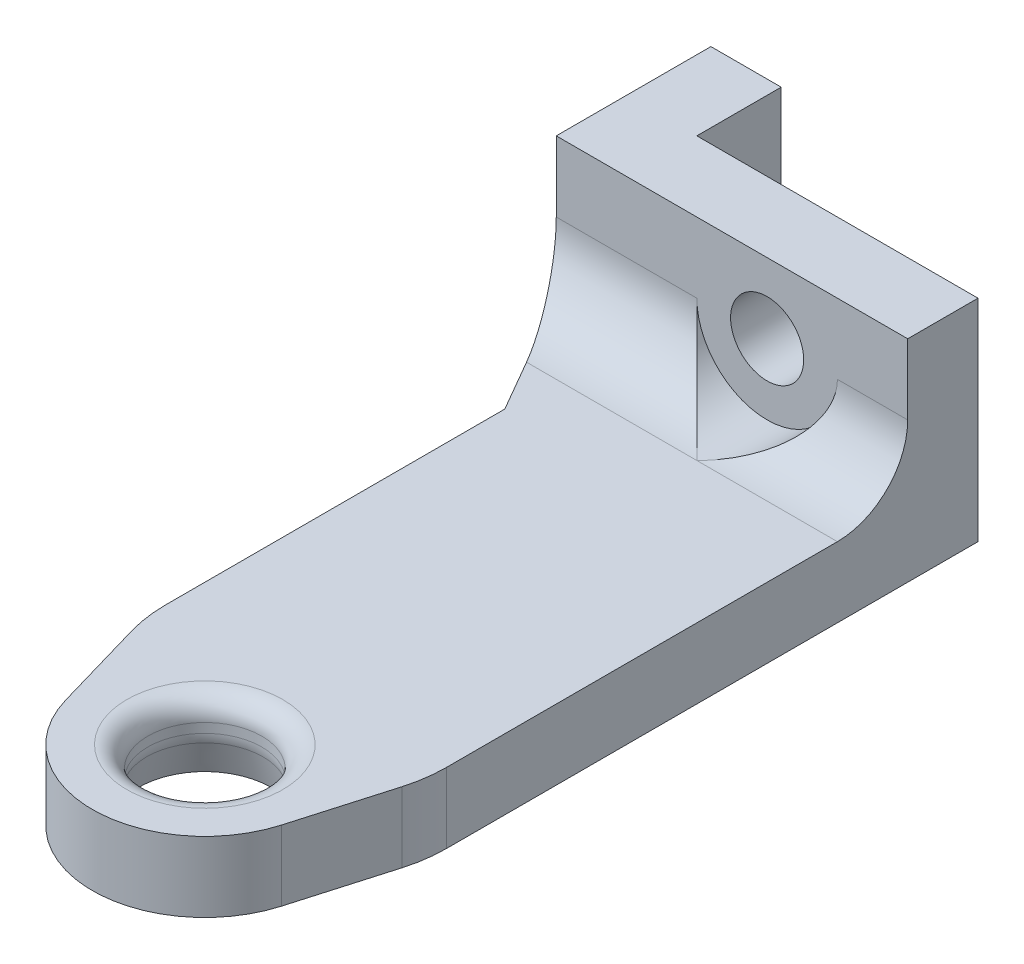
from build123d import *

# Parameters (mm, degrees)
SKETCH2_R           = 4.05
BOSS_EXTRUDE1_DEPTH = 5
FILLET1_R           = 10
SKETCH3_W           = 20
SKETCH3_H           = 15
BOSS_EXTRUDE2_DEPTH = 5
SKETCH6_R           = 2.6
CUT_EXTRUDE1_DEPTH  = 52.273774973
SKETCH4_W           = 11
SKETCH4_H           = 15
BOSS_EXTRUDE3_DEPTH = 5
CHAMFER1_SIZE2      = 5
CHAMFER1_SIZE       = 8.660254038
FILLET2_R           = 5
SKETCH7_R           = 5
CUT_EXTRUDE3_DEPTH  = 53.478567054
CHAMFER2_SIZE       = 2.5
CHAMFER2_SIZE2      = 0.669872981
FILLET3_R           = 2.5
FILLET4_R           = 1.5
SKETCH8_W           = 0.542735043
SKETCH8_H           = 2.03525641
CUT_EXTRUDE4_DEPTH  = 0.4


# Some blends are built 0.0001 mm under size
with BuildPart() as part:
    # Sketch2 → Boss-Extrude1 (new body)
    with BuildSketch(Plane(origin=(0, 0, 0), x_dir=(1, 0, 0), z_dir=(0, 1, 0))):
        with BuildLine():
            Line((-7.684618874, -2.224102688), (-10, 5.775897312))
            Line((-10, 5.775897312), (-10, 45))
            Line((-10, 45), (10, 45))
            Line((10, 45), (10, 5.775897312))
            Line((10, 5.775897312), (7.684618874, -2.224102688))
            ThreePointArc((7.684618874, -2.224102688), (0, -8), (-7.684618874, -2.224102688))
        make_face()
        with Locations(Location((0, 0, 0), (0, 0, 270))):
            Circle(SKETCH2_R, mode=Mode.SUBTRACT)
    extrude(amount=BOSS_EXTRUDE1_DEPTH)

    # Fillet1
    fillet1_edges = [part.edges().sort_by_distance(p)[0] for p in [
        (-10, 2.5, -5.775897312),
        (10, 2.5, -5.775897312),
    ]]
    fillet(fillet1_edges, radius=FILLET1_R)

    # Sketch3 → Boss-Extrude2 (add)
    with BuildSketch(Plane(origin=(0, 0, -45), x_dir=(-1, 0, 0), z_dir=(0, 0, -1))):
        with Locations((0, 7.5)):
            Rectangle(SKETCH3_W, SKETCH3_H)
    extrude(amount=-BOSS_EXTRUDE2_DEPTH)

    # Sketch6 → Cut-Extrude1 (cut, through all)
    with BuildSketch(Plane.XY.offset(-40)):
        with Locations((0, 10)):
            Circle(SKETCH6_R)
    extrude(amount=-CUT_EXTRUDE1_DEPTH, mode=Mode.SUBTRACT)

    # Sketch4 → Boss-Extrude3 (add)
    with BuildSketch(Plane.ZY.offset(10)):
        with Locations((-45.5, 7.5)):
            Rectangle(SKETCH4_W, SKETCH4_H)
    extrude(amount=BOSS_EXTRUDE3_DEPTH)

    # Chamfer1
    chamfer1_edges = [part.edges().sort_by_distance(p)[0] for p in [
        (-10, 2.5, -40),
    ]]
    chamfer1_side = [part.faces().sort_by_distance(p)[0] for p in [
        (-10, 2.5, -39.9),
    ]]
    chamfer(chamfer1_edges, length=CHAMFER1_SIZE - 0.0001, length2=CHAMFER1_SIZE2 - 0.0001, reference=chamfer1_side[0])  # a hair under: the kernel refuses the full size

    # Fillet2
    # the kernel refuses this fillet: 5 mm, written as the material it adds along each edge
    with BuildSketch(Plane(origin=(10, 5, -40), x_dir=(0, 0, 1), z_dir=(-1, 0, 0))) as fillet2_piece_1_section:
        with BuildLine():
            CenterArc((FILLET2_R, FILLET2_R), FILLET2_R, 180, 90)
            Line((0, FILLET2_R), (0, 0))
            Line((0, 0), (FILLET2_R, 0))
        make_face()
    fillet2_piece_1 = extrude(amount=37.4999, mode=Mode.PRIVATE)
    fillet2_piece_1 = split(fillet2_piece_1, bisect_by=Plane(origin=(-11.31874523, 6.103581905, -33.623999011), z_dir=(0.8660272339345468, 0, -0.4999968300736293)), keep=Keep.TOP, mode=Mode.PRIVATE)
    fillet2_piece_1 = fillet2_piece_1 - Plane(origin=(0, 10, -38.876099695), x_dir=(1, 0, 0), z_dir=(0, 0, 1)) * Cylinder(2.6, 95, mode=Mode.PRIVATE)
    fillet2_piece_1 = split(fillet2_piece_1, bisect_by=Plane(origin=(-15, 6.103581905, -38.876099695), z_dir=(1, 0, 0)), keep=Keep.TOP, mode=Mode.PRIVATE)
    add(fillet2_piece_1)

    # Sketch7 → Cut-Extrude3 (cut, through all)
    with BuildSketch(Plane.XY.offset(-40)):
        with Locations((0, 10)):
            Circle(SKETCH7_R)
    extrude(amount=CUT_EXTRUDE3_DEPTH, mode=Mode.SUBTRACT)

    # Chamfer2
    chamfer2_edges = [part.edges().sort_by_distance(p)[0] for p in [
        (0, 0, -4.05),
    ]]
    chamfer2_side = [part.faces().sort_by_distance(p)[0] for p in [
        (0, 2.5, -4.05),
    ]]
    chamfer(chamfer2_edges, length=CHAMFER2_SIZE, length2=CHAMFER2_SIZE2, reference=chamfer2_side[0])

    # Fillet3
    fillet3_edges = [part.edges().sort_by_distance(p)[0] for p in [
        (0, 2.5, -4.05),
    ]]
    fillet(fillet3_edges, radius=FILLET3_R)

    # Fillet4
    fillet4_edges = [part.edges().sort_by_distance(p)[0] for p in [
        (0, 5, -4.05),
    ]]
    fillet(fillet4_edges, radius=FILLET4_R)

    # Sketch8 → Cut-Extrude4 (cut)
    # profile 1 of 6: a face of its own
    with BuildSketch(Plane.XZ):
        with BuildLine():
            Line((-2.291666667, -36.651175214), (-2.291666667, -35.618706597))
            add(Edge.make_bspline(
                [(-2.291666667, -35.618706597), (-2.291405132, -35.568165125), (-2.290898213, -35.470203173), (-2.282853771, -35.327763182), (-2.272159447, -35.194301861), (-2.254220293, -35.070055051), (-2.235619757, -34.954214297), (-2.208318623, -34.847955627), (-2.178163526, -34.750388992), (-2.131765816, -34.633231433), (-2.059709589, -34.500300129), (-1.952843356, -34.357423851), (-1.824719372, -34.233227072), (-1.678711987, -34.127622996), (-1.518087317, -34.042873478), (-1.346301255, -33.982336608), (-1.166243896, -33.943445417), (-1.042797928, -33.939495981), (-0.980410323, -33.9375)],
                knots=[0, 0, 0, 0, 1.00128172, 1.940733171, 2.826250472, 3.653024905, 4.427672124, 5.149348099, 5.824709082, 6.450061444, 7.643590664, 8.808605388, 9.972104426, 11.165284501, 12.367876273, 13.557044126, 14.765369432, 16, 16, 16, 16], degree=3))
            add(Edge.make_bspline(
                [(-0.980410323, -33.9375), (-0.92197391, -33.939162507), (-0.807140846, -33.942429489), (-0.639473873, -33.973288932), (-0.480032383, -34.022267279), (-0.328952834, -34.08995733), (-0.189047585, -34.177172174), (-0.060750024, -34.281667816), (0.051090906, -34.407218494), (0.113592766, -34.501331705), (0.145340879, -34.549136952)],
                knots=[0, 0, 0, 0, 1.044641374, 2.052818814, 3.038628718, 4.023282556, 5.005660861, 5.98021751, 6.974042014, 8, 8, 8, 8], degree=3))
            add(Edge.make_bspline(
                [(0.145340879, -34.549136952), (0.168427577, -34.489028777), (0.212598148, -34.374026948), (0.290569098, -34.21567636), (0.375681842, -34.079744802), (0.467193244, -33.963576922), (0.567287581, -33.864748126), (0.676778076, -33.779156673), (0.79557509, -33.705161195), (0.92324201, -33.642191555), (1.058696543, -33.592728117), (1.200284247, -33.556373176), (1.347462345, -33.534868439), (1.447340349, -33.531934862), (1.497938368, -33.530448718)],
                knots=[0, 0, 0, 0, 1.272586185, 2.434772614, 3.483318042, 4.437947805, 5.351807173, 6.25737843, 7.180033415, 8.1141739, 9.066731021, 10.025721652, 10.999834114, 12, 12, 12, 12], degree=3))
            add(Edge.make_bspline(
                [(1.497938368, -33.530448718), (1.549595635, -33.531925293), (1.651232755, -33.534830497), (1.80053811, -33.556273874), (1.943235076, -33.592556412), (2.080180884, -33.642619183), (2.211088406, -33.707508867), (2.335483408, -33.787618814), (2.453624692, -33.881824442), (2.565720763, -33.988292029), (2.668292193, -34.106941825), (2.756469031, -34.237701537), (2.832288545, -34.376988986), (2.89401809, -34.526584829), (2.941642392, -34.686107179), (2.974823432, -34.855467269), (2.997218281, -35.034386188), (2.999057027, -35.157168496), (3, -35.22013555)],
                knots=[0, 0, 0, 0, 0.978680899, 1.925582087, 2.851223405, 3.764209995, 4.683484765, 5.614004905, 6.562443559, 7.542772147, 8.539900013, 9.527881485, 10.525548727, 11.540192123, 12.58875426, 13.674701727, 14.807505862, 16, 16, 16, 16], degree=3))
            Line((3, -35.22013555), (3, -36.651175214))
            Line((3, -36.651175214), (-2.291666667, -36.651175214))
        make_face()
        with BuildLine():
            Line((-1.748931624, -36.176282051), (-0.052884615, -36.176282051))
            Line((-0.052884615, -36.176282051), (-0.052884615, -35.857213208))
            add(Edge.make_bspline(
                [(-0.052884615, -35.857213208), (-0.053489261, -35.810572767), (-0.054657559, -35.720453931), (-0.058004187, -35.58994647), (-0.067375034, -35.468805068), (-0.076743206, -35.35723886), (-0.09197498, -35.255423448), (-0.110106069, -35.163584679), (-0.129280956, -35.080280315), (-0.161893899, -34.984216823), (-0.210076793, -34.87523413), (-0.284925308, -34.759130076), (-0.374004491, -34.656299664), (-0.47775097, -34.570506474), (-0.590749128, -34.499671386), (-0.712006948, -34.450049179), (-0.839084272, -34.416967531), (-0.926491474, -34.413933571), (-0.970870059, -34.412393162)],
                knots=[0, 0, 0, 0, 1.156917035, 2.235399477, 3.236897345, 4.169954739, 5.01148057, 5.788325709, 6.491867502, 7.129259015, 8.302032419, 9.437271567, 10.542795419, 11.662606952, 12.764338259, 13.836858145, 14.901724648, 16, 16, 16, 16], degree=3))
            add(Edge.make_bspline(
                [(-0.970870059, -34.412393162), (-1.000243825, -34.413175287), (-1.057863676, -34.414709511), (-1.142133004, -34.42773128), (-1.221315262, -34.448830002), (-1.296170402, -34.477403358), (-1.364838095, -34.516438804), (-1.430599459, -34.561686014), (-1.48951571, -34.617550119), (-1.544423308, -34.680681517), (-1.593565423, -34.752915097), (-1.63427205, -34.835807132), (-1.671165779, -34.927214737), (-1.698477109, -35.029617849), (-1.722493142, -35.140894642), (-1.737582577, -35.262551845), (-1.747292771, -35.393818542), (-1.748373155, -35.484769875), (-1.748931624, -35.531784188)],
                knots=[0, 0, 0, 0, 0.911708768, 1.788416306, 2.640049961, 3.452993646, 4.268229297, 5.087074648, 5.92553149, 6.781184137, 7.681934069, 8.628939405, 9.643570426, 10.73771997, 11.914765019, 13.176320755, 14.540391495, 16, 16, 16, 16], degree=3))
            Line((-1.748931624, -35.531784188), (-1.748931624, -36.176282051))
        make_face(mode=Mode.SUBTRACT)
        with BuildLine():
            Line((0.489850427, -36.176282051), (2.457264957, -36.176282051))
            Line((2.457264957, -36.176282051), (2.457264957, -35.499983307))
            add(Edge.make_bspline(
                [(2.457264957, -35.499983307), (2.456627077, -35.451578803), (2.455397648, -35.358285504), (2.452514381, -35.223479932), (2.441607418, -35.098862051), (2.431545793, -34.984038735), (2.414340848, -34.879314727), (2.398103854, -34.783884484), (2.374001195, -34.699314558), (2.340874926, -34.60034818), (2.287843881, -34.489726643), (2.210366026, -34.368837215), (2.114746392, -34.263423508), (2.005997167, -34.17293568), (1.888079822, -34.098261195), (1.762535899, -34.044675189), (1.631806991, -34.011374934), (1.542651073, -34.007356946), (1.497938368, -34.00534188)],
                knots=[0, 0, 0, 0, 1.160376723, 2.23647316, 3.230273494, 4.158083346, 4.997711197, 5.773399541, 6.476071462, 7.102777513, 8.27340052, 9.405620712, 10.53304798, 11.669441455, 12.787990954, 13.865552736, 14.929550474, 16, 16, 16, 16], degree=3))
            add(Edge.make_bspline(
                [(1.497938368, -34.00534188), (1.469977596, -34.005758045), (1.414507062, -34.006583663), (1.333000258, -34.019091564), (1.254007275, -34.037186532), (1.177198938, -34.061018126), (1.103866677, -34.09433341), (1.033729262, -34.135175156), (0.965373798, -34.18192579), (0.877838706, -34.254053177), (0.778235912, -34.360494799), (0.68192319, -34.511760222), (0.602995846, -34.682804715), (0.569628744, -34.807151532), (0.552392161, -34.871385884)],
                knots=[0, 0, 0, 0, 0.723302347, 1.434937762, 2.129609326, 2.821140842, 3.513216847, 4.209993937, 4.920569932, 5.655069131, 7.14393391, 8.6716197, 10.280644748, 12, 12, 12, 12], degree=3))
            add(Edge.make_bspline(
                [(0.552392161, -34.871385884), (0.547168403, -34.897132255), (0.535842218, -34.952955698), (0.523886524, -35.043983826), (0.513235064, -35.147905913), (0.50535629, -35.26496193), (0.497212349, -35.395299976), (0.494045179, -35.539198412), (0.490266536, -35.69606959), (0.489992678, -35.804915201), (0.489850427, -35.861453325)],
                knots=[0, 0, 0, 0, 0.634451884, 1.375622551, 2.216452059, 3.157844607, 4.20941857, 5.370758133, 6.634282058, 8, 8, 8, 8], degree=3))
            Line((0.489850427, -35.861453325), (0.489850427, -36.176282051))
        make_face(mode=Mode.SUBTRACT)
    # profile 2 of 6: a face of its own
    with BuildSketch(Plane.XZ):
        Polygon((-2.291666667, -32.444978632), (-2.291666667, -31.97008547), (2.457264957, -31.97008547), (2.457264957, -29.93482906), (3, -29.93482906), (3, -32.444978632), align=None)
    # profile 3 of 6: a face of its own
    with BuildSketch(Plane.XZ):
        with BuildLine():
            Line((-2.291666667, -29.052884615), (-2.291666667, -27.993915264))
            add(Edge.make_bspline(
                [(-2.291666667, -27.993915264), (-2.291431435, -27.92324713), (-2.290979766, -27.787556483), (-2.288461291, -27.593165943), (-2.28124292, -27.416534499), (-2.275031133, -27.257754504), (-2.263704031, -27.11682887), (-2.252877814, -26.993325467), (-2.238705732, -26.887813114), (-2.225543962, -26.823941411), (-2.219584669, -26.795022035)],
                knots=[0, 0, 0, 0, 1.410062039, 2.707475311, 3.878576406, 4.937260626, 5.877586885, 6.699081471, 7.410979367, 8, 8, 8, 8], degree=3))
            add(Edge.make_bspline(
                [(-2.219584669, -26.795022035), (-2.210019176, -26.756307288), (-2.191092249, -26.679703685), (-2.151088227, -26.569409696), (-2.104792892, -26.46431227), (-2.050424199, -26.364838447), (-1.987548423, -26.271521625), (-1.917362949, -26.183268209), (-1.840009535, -26.100364674), (-1.754790866, -26.023892976), (-1.663522649, -25.954429825), (-1.566455374, -25.893499941), (-1.463990393, -25.84201531), (-1.355968109, -25.80161309), (-1.243581792, -25.767711188), (-1.12568437, -25.744933286), (-1.002669421, -25.730744878), (-0.918968364, -25.729343203), (-0.876527444, -25.728632479)],
                knots=[0, 0, 0, 0, 1.02737844, 2.032840108, 3.019645024, 3.985760442, 4.950801802, 5.916702504, 6.889791722, 7.870143693, 8.864820395, 9.842884691, 10.820524757, 11.815201459, 12.812418953, 13.84314332, 14.906358105, 16, 16, 16, 16], degree=3))
            add(Edge.make_bspline(
                [(-0.876527444, -25.728632479), (-0.806019607, -25.730853464), (-0.668440556, -25.735187181), (-0.46877708, -25.775592993), (-0.282526569, -25.841778921), (-0.109923533, -25.932981989), (0.045667562, -26.049125721), (0.182329322, -26.188712012), (0.296689666, -26.351818734), (0.375993311, -26.503658295), (0.426782589, -26.637785716), (0.462518513, -26.748205129), (0.490128865, -26.868654012), (0.514863826, -26.997978315), (0.533538412, -27.136716223), (0.547216001, -27.284535211), (0.555764384, -27.441540702), (0.557037415, -27.549398581), (0.557692308, -27.604884482)],
                knots=[0, 0, 0, 0, 1.260483769, 2.459530307, 3.627416485, 4.787058657, 5.939039949, 7.08810263, 8.267026773, 9.491475466, 10.141966685, 10.831826277, 11.566392101, 12.351337768, 13.187381173, 14.07005841, 15.007169909, 16, 16, 16, 16], degree=3))
            Line((0.557692308, -27.604884482), (3, -25.660790598))
            Line((3, -25.660790598), (3, -26.248046875))
            Line((3, -26.248046875), (0.557692308, -28.192140759))
            Line((0.557692308, -28.192140759), (0.557692308, -28.577991453))
            Line((0.557692308, -28.577991453), (3, -28.577991453))
            Line((3, -28.577991453), (3, -29.052884615))
            Line((3, -29.052884615), (-2.291666667, -29.052884615))
        make_face()
        with BuildLine():
            Line((-1.748931624, -28.577991453), (0.014957265, -28.577991453))
            Line((0.014957265, -28.577991453), (0.022377471, -27.609124599))
            add(Edge.make_bspline(
                [(0.022377471, -27.609124599), (0.022397495, -27.563888344), (0.022436307, -27.476207598), (0.016397941, -27.349357863), (0.009529412, -27.231247422), (-0.000979125, -27.122329572), (-0.014513976, -27.022550595), (-0.031470988, -26.931976927), (-0.051142008, -26.850406682), (-0.081903638, -26.755580285), (-0.128511472, -26.648440092), (-0.200901812, -26.53454777), (-0.28788413, -26.434616396), (-0.39021953, -26.353229714), (-0.500949552, -26.285040934), (-0.621208277, -26.239152597), (-0.747094629, -26.208569968), (-0.833588357, -26.205226469), (-0.877587473, -26.203525641)],
                knots=[0, 0, 0, 0, 1.146477201, 2.22219935, 3.21835465, 4.145220026, 4.995151787, 5.769831222, 6.480173269, 7.120302478, 8.295254187, 9.430763426, 10.528629691, 11.636497428, 12.733230534, 13.811001502, 14.886462612, 16, 16, 16, 16], degree=3))
            add(Edge.make_bspline(
                [(-0.877587473, -26.203525641), (-0.920138942, -26.205348379), (-1.004460427, -26.208960382), (-1.127967257, -26.238288162), (-1.244569168, -26.288426937), (-1.35441671, -26.354384717), (-1.45257154, -26.437162012), (-1.537466125, -26.532358387), (-1.606964031, -26.639955522), (-1.653154856, -26.73963391), (-1.680280691, -26.829442143), (-1.699996598, -26.907046756), (-1.713680172, -26.995163706), (-1.726641012, -27.093392265), (-1.737133161, -27.201919896), (-1.744370503, -27.321064684), (-1.748609016, -27.450088565), (-1.748821585, -27.539512688), (-1.748931624, -27.585803953)],
                knots=[0, 0, 0, 0, 1.100823979, 2.181431445, 3.263702604, 4.376021382, 5.48638238, 6.575013887, 7.666064109, 8.791843368, 9.405226397, 10.093019944, 10.863016055, 11.711746407, 12.658404307, 13.684961631, 14.801597923, 16, 16, 16, 16], degree=3))
            Line((-1.748931624, -27.585803953), (-1.748931624, -28.577991453))
        make_face(mode=Mode.SUBTRACT)
    # profile 4 of 6: a face of its own
    with BuildSketch(Plane.XZ):
        with Locations((0.96474359, -24.03258547)):
            Rectangle(SKETCH8_W, SKETCH8_H)
    # profile 5 of 6: a face of its own
    with BuildSketch(Plane.XZ):
        with BuildLine():
            add(Edge.make_bspline(
                [(0.356286725, -22.607905983), (0.271472818, -22.607410051), (0.10672058, -22.606446695), (-0.133346677, -22.595729678), (-0.358560447, -22.577926482), (-0.56893151, -22.55352831), (-0.764514182, -22.523837558), (-0.944785767, -22.484202227), (-1.110580689, -22.439128147), (-1.262439362, -22.386888011), (-1.40240851, -22.327942632), (-1.533073498, -22.263784501), (-1.654246443, -22.191876628), (-1.767826261, -22.116296397), (-1.872078268, -22.034101479), (-1.968203643, -21.947054289), (-2.055391743, -21.853413872), (-2.133702276, -21.754088453), (-2.202369187, -21.649751208), (-2.263225844, -21.543253282), (-2.313353149, -21.432691796), (-2.354358664, -21.319522228), (-2.387832412, -21.20350606), (-2.410825447, -21.084672911), (-2.425266903, -20.962747315), (-2.42664933, -20.880452652), (-2.427350427, -20.838716947)],
                knots=[0, 0, 0, 0, 1.646148282, 3.197666765, 4.66315463, 6.030252048, 7.307778049, 8.501004361, 9.610818041, 10.641065266, 11.615491391, 12.557119604, 13.464013759, 14.348536654, 15.203310953, 16.038349431, 16.863300206, 17.683791446, 18.490318933, 19.285717724, 20.06220424, 20.843281102, 21.620494212, 22.403315558, 23.190242141, 24, 24, 24, 24], degree=3))
            add(Edge.make_bspline(
                [(-2.427350427, -20.838716947), (-2.426766454, -20.796611945), (-2.425604553, -20.71283781), (-2.4092501, -20.58942836), (-2.388140934, -20.468168491), (-2.354285307, -20.350897957), (-2.313772659, -20.235399396), (-2.260316864, -20.124545026), (-2.202179536, -20.014421101), (-2.131256885, -19.910030404), (-2.052875685, -19.808253932), (-1.963892985, -19.712849115), (-1.866771391, -19.621377153), (-1.759344807, -19.537292904), (-1.6432604, -19.456992635), (-1.517545051, -19.383524625), (-1.38247736, -19.315360873), (-1.238683482, -19.251220083), (-1.08232246, -19.195130655), (-0.914369559, -19.145262671), (-0.733303883, -19.104387419), (-0.540134084, -19.070584305), (-0.333903201, -19.044346654), (-0.115029082, -19.025251335), (0.116625204, -19.015161118), (0.275009144, -19.013261268), (0.356286725, -19.012286325)],
                knots=[0, 0, 0, 0, 0.810910589, 1.61342667, 2.396193133, 3.181089899, 3.963115317, 4.752255436, 5.550715454, 6.36105385, 7.181178335, 8.024612154, 8.872680183, 9.750181803, 10.651284446, 11.591556747, 12.554036451, 13.566402641, 14.62422919, 15.753422176, 16.94128843, 18.199818041, 19.531985927, 20.947085226, 22.433341622, 24, 24, 24, 24], degree=3))
            add(Edge.make_bspline(
                [(0.356286725, -19.012286325), (0.437209068, -19.013282717), (0.595235899, -19.015228492), (0.825858718, -19.025034928), (1.043553058, -19.044813064), (1.248551014, -19.069192106), (1.44094763, -19.103373035), (1.620617541, -19.144558227), (1.78819686, -19.191482628), (1.942484903, -19.248432878), (2.086029255, -19.311080739), (2.220103801, -19.379171346), (2.345785951, -19.452224764), (2.462176548, -19.531320716), (2.56917194, -19.616788065), (2.666626644, -19.708195914), (2.756175312, -19.804433726), (2.835420039, -19.906803537), (2.906882659, -20.01216657), (2.967129759, -20.122301683), (3.019330335, -20.234390222), (3.062009122, -20.349551285), (3.095107019, -20.46760707), (3.117860021, -20.588950051), (3.133853634, -20.712855225), (3.135071606, -20.79661777), (3.135683761, -20.838716947)],
                knots=[0, 0, 0, 0, 1.561645053, 3.049612875, 4.452756685, 5.778837748, 7.032101753, 8.221335837, 9.334924186, 10.387562255, 11.392109817, 12.355697819, 13.287721948, 14.19548756, 15.068665045, 15.927346723, 16.771751757, 17.602390507, 18.423119567, 19.225778204, 20.022010933, 20.807278863, 21.593079439, 22.384715467, 23.188155646, 24, 24, 24, 24], degree=3))
            add(Edge.make_bspline(
                [(3.135683761, -20.838716947), (3.134978676, -20.880451738), (3.133588386, -20.962744601), (3.11920453, -21.084683387), (3.096079185, -21.203038985), (3.063699322, -21.318395439), (3.024064974, -21.431344557), (2.972427903, -21.540347344), (2.912958363, -21.646615371), (2.845232615, -21.74986668), (2.767636587, -21.848155128), (2.681824031, -21.942056584), (2.585594425, -22.02912524), (2.4804628, -22.110607454), (2.366713996, -22.186986704), (2.244271675, -22.258273198), (2.112926767, -22.323776773), (1.971851431, -22.383729224), (1.818914934, -22.43688376), (1.652697385, -22.483654562), (1.471510509, -22.521008965), (1.276274226, -22.552672596), (1.066591834, -22.578045078), (0.842387469, -22.595722285), (0.604086879, -22.606438559), (0.440394086, -22.607407916), (0.356286725, -22.607905983)],
                knots=[0, 0, 0, 0, 0.810927267, 1.598990287, 2.382942141, 3.152806972, 3.926217614, 4.706701772, 5.493896336, 6.292070767, 7.104102563, 7.925577746, 8.761822141, 9.623241997, 10.509042271, 11.423174113, 12.375371989, 13.360203808, 14.400680605, 15.520553799, 16.714061498, 17.994519714, 19.364400916, 20.818312473, 22.365209998, 24, 24, 24, 24], degree=3))
        make_face()
        with BuildLine():
            add(Edge.make_bspline(
                [(0.354166667, -22.133012821), (0.424845964, -22.132828268), (0.562020603, -22.132470088), (0.761006658, -22.12338368), (0.946912785, -22.110736327), (1.119666427, -22.094825229), (1.278663815, -22.070996097), (1.424565959, -22.04396049), (1.557102796, -22.01153293), (1.677432541, -21.972976119), (1.787259112, -21.929056158), (1.889509777, -21.881187474), (1.985396395, -21.829307212), (2.074686333, -21.77235194), (2.156288119, -21.709195612), (2.232270172, -21.642766164), (2.299989902, -21.570070984), (2.381222674, -21.46952813), (2.465160955, -21.336786111), (2.53825605, -21.169539156), (2.584191327, -20.997683124), (2.590032972, -20.881037802), (2.592948718, -20.822816506)],
                knots=[0, 0, 0, 0, 1.459098681, 2.831824031, 4.11146945, 5.306290378, 6.412266529, 7.42953815, 8.369053297, 9.227277979, 10.03601793, 10.809473603, 11.557037441, 12.285528272, 12.993193355, 13.685654407, 14.36688038, 15.041354379, 16.352855396, 17.594313975, 18.799247529, 20, 20, 20, 20], degree=3))
            add(Edge.make_bspline(
                [(2.592948718, -20.822816506), (2.590395634, -20.76425819), (2.585298522, -20.647349276), (2.540812942, -20.475651111), (2.468493515, -20.310344756), (2.385870284, -20.179886734), (2.306681713, -20.080912006), (2.239243685, -20.009972082), (2.163710982, -19.944868007), (2.082221544, -19.883118223), (1.993211631, -19.826483795), (1.897111163, -19.774983539), (1.793652737, -19.727988488), (1.721429445, -19.701214096), (1.684503539, -19.68752504)],
                knots=[0, 0, 0, 0, 1.353621445, 2.702441307, 4.075953605, 5.516772412, 6.261413105, 7.007624062, 7.778524365, 8.566925914, 9.372323995, 10.217594641, 11.088702136, 12, 12, 12, 12], degree=3))
            add(Edge.make_bspline(
                [(1.684503539, -19.68752504), (1.637287147, -19.671571772), (1.541417623, -19.639179796), (1.392701149, -19.597433423), (1.236668398, -19.564556451), (1.074251853, -19.534978505), (0.904253734, -19.514789956), (0.727200034, -19.498540286), (0.54295726, -19.48896889), (0.417779119, -19.487782421), (0.354166667, -19.487179487)],
                knots=[0, 0, 0, 0, 0.884706709, 1.796334032, 2.740027952, 3.714592787, 4.726048262, 5.777819803, 6.87074269, 8, 8, 8, 8], degree=3))
            add(Edge.make_bspline(
                [(0.354166667, -19.487179487), (0.290564503, -19.488011321), (0.166145076, -19.489638565), (-0.016066935, -19.495858523), (-0.189131289, -19.511920356), (-0.35379355, -19.529759501), (-0.509142225, -19.556062439), (-0.656477793, -19.584422468), (-0.793975029, -19.622524259), (-0.92378639, -19.66322454), (-1.044437895, -19.709806423), (-1.156489101, -19.761085514), (-1.260491283, -19.81584331), (-1.356123103, -19.875346187), (-1.443939269, -19.938765329), (-1.521919136, -20.008374591), (-1.593855995, -20.079753268), (-1.674502526, -20.181268793), (-1.757380149, -20.313089791), (-1.831574439, -20.47825111), (-1.875484622, -20.649185956), (-1.881573992, -20.764981388), (-1.884615385, -20.822816506)],
                knots=[0, 0, 0, 0, 1.313483664, 2.569454835, 3.763100662, 4.901599063, 5.988328865, 7.015709358, 7.99797933, 8.932480776, 9.824041341, 10.666387587, 11.475829342, 12.24921787, 12.990555181, 13.709176526, 14.405678811, 15.080244297, 16.38186033, 17.610124501, 18.806354173, 20, 20, 20, 20], degree=3))
            add(Edge.make_bspline(
                [(-1.884615385, -20.822816506), (-1.881566425, -20.881352126), (-1.875462951, -20.998530002), (-1.83177751, -21.171290272), (-1.757597227, -21.337567355), (-1.674662199, -21.469823051), (-1.594165202, -21.570105333), (-1.52565299, -21.641267992), (-1.451485734, -21.708618726), (-1.369160047, -21.770139628), (-1.280184723, -21.826757172), (-1.185538085, -21.88064242), (-1.083096367, -21.927870974), (-0.973355914, -21.971931937), (-0.85301955, -22.010553061), (-0.720003149, -22.0426101), (-0.573752581, -22.071794244), (-0.413593467, -22.092811584), (-0.240802954, -22.111318748), (-0.054421404, -22.123244835), (0.145247951, -22.132511713), (0.283132309, -22.132842439), (0.354166667, -22.133012821)],
                knots=[0, 0, 0, 0, 1.207546505, 2.417292871, 3.651582144, 4.952510111, 5.626719005, 6.30238548, 6.989136872, 7.692112372, 8.420316868, 9.164734959, 9.937886623, 10.746308695, 11.604196049, 12.543341915, 13.568754172, 14.680483261, 15.875568977, 17.154711427, 18.534182925, 20, 20, 20, 20], degree=3))
        make_face(mode=Mode.SUBTRACT)
    # profile 6 of 6: a face of its own
    with BuildSketch(Plane.XZ):
        with BuildLine():
            Line((-1.070512821, -17.858974359), (-1.070512821, -18.333867521))
            add(Edge.make_bspline(
                [(-1.070512821, -18.333867521), (-1.123780981, -18.321001891), (-1.227915877, -18.295850636), (-1.376698283, -18.24339121), (-1.517492179, -18.186242336), (-1.647661243, -18.117618333), (-1.769821489, -18.042765811), (-1.881202189, -17.957006459), (-1.984636077, -17.864296878), (-2.07642871, -17.761752014), (-2.1595498, -17.654212252), (-2.230420423, -17.540162291), (-2.291386702, -17.421896726), (-2.341612528, -17.298596156), (-2.379448737, -17.169893491), (-2.406900098, -17.036952275), (-2.424727139, -16.899424126), (-2.426466984, -16.80606765), (-2.427350427, -16.758663862)],
                knots=[0, 0, 0, 0, 1.162005537, 2.271625781, 3.343758855, 4.383309926, 5.390229558, 6.379919256, 7.361854164, 8.333198761, 9.295911338, 10.242430842, 11.177959212, 12.116337295, 13.062827104, 14.020064771, 14.994644689, 16, 16, 16, 16], degree=3))
            add(Edge.make_bspline(
                [(-2.427350427, -16.758663862), (-2.425265163, -16.689595907), (-2.421140119, -16.552966569), (-2.383471864, -16.352241486), (-2.323864818, -16.158677129), (-2.241505731, -15.974392194), (-2.139924912, -15.803216707), (-2.019025846, -15.650913187), (-1.881141187, -15.519546033), (-1.728843144, -15.409336677), (-1.566078266, -15.323044714), (-1.398558981, -15.259414125), (-1.226682667, -15.220676584), (-1.110632971, -15.215656218), (-1.052492321, -15.213141026)],
                knots=[0, 0, 0, 0, 1.083050992, 2.142477498, 3.193116406, 4.255571735, 5.30263384, 6.308962982, 7.297363603, 8.282367274, 9.249857812, 10.179914175, 11.08814088, 12, 12, 12, 12], degree=3))
            add(Edge.make_bspline(
                [(-1.052492321, -15.213141026), (-0.996541572, -15.214900264), (-0.887054638, -15.218342822), (-0.727213803, -15.247573543), (-0.576565193, -15.296765274), (-0.434474627, -15.364906463), (-0.301843024, -15.45311333), (-0.178371975, -15.559963717), (-0.063513843, -15.686211789), (0.002283456, -15.781883517), (0.036157853, -15.831138154)],
                knots=[0, 0, 0, 0, 1.024540389, 2.004866551, 2.965041327, 3.920577974, 4.882998113, 5.874504559, 6.905732034, 8, 8, 8, 8], degree=3))
            add(Edge.make_bspline(
                [(0.036157853, -15.831138154), (0.063240599, -15.774775537), (0.116986313, -15.662923912), (0.224064639, -15.512003429), (0.344661412, -15.372910479), (0.439824257, -15.296252701), (0.487730369, -15.25766226)],
                knots=[0, 0, 0, 0, 1.015663554, 2.015584519, 3.001021554, 4, 4, 4, 4], degree=3))
            add(Edge.make_bspline(
                [(0.487730369, -15.25766226), (0.522591493, -15.232199754), (0.591742867, -15.181691709), (0.702922939, -15.119347509), (0.81533531, -15.062788491), (0.931992983, -15.018716135), (1.051543849, -14.984586599), (1.174193186, -14.960190455), (1.300041149, -14.945034908), (1.385180256, -14.94286449), (1.427976429, -14.941773504)],
                knots=[0, 0, 0, 0, 1.025084078, 2.033381695, 3.024893161, 4.013698104, 4.991890475, 5.976764909, 6.982997093, 8, 8, 8, 8], degree=3))
            add(Edge.make_bspline(
                [(1.427976429, -14.941773504), (1.502074081, -14.944487029), (1.64992068, -14.949901308), (1.868358382, -14.998282555), (2.081855738, -15.073315918), (2.286161559, -15.179751807), (2.477133509, -15.310054017), (2.649264044, -15.463360296), (2.794901178, -15.641862345), (2.918059068, -15.83909094), (3.015590354, -16.053689116), (3.08588736, -16.282281473), (3.128051444, -16.523545118), (3.13311069, -16.688533265), (3.135683761, -16.772444244)],
                knots=[0, 0, 0, 0, 0.955697303, 1.906897079, 2.875188111, 3.870982192, 4.871999088, 5.854111427, 6.836107184, 7.836239895, 8.848948182, 9.870701427, 10.917064451, 12, 12, 12, 12], degree=3))
            add(Edge.make_bspline(
                [(3.135683761, -16.772444244), (3.134359656, -16.829015101), (3.131754259, -16.940327684), (3.114260381, -17.104032261), (3.081440588, -17.259964803), (3.040165155, -17.409639475), (2.983097246, -17.550797324), (2.915061725, -17.685468773), (2.834313912, -17.81306351), (2.740718012, -17.932823793), (2.635951399, -18.044621671), (2.518273604, -18.145608907), (2.389880905, -18.236902816), (2.249618388, -18.317923328), (2.097878908, -18.389011427), (1.934054417, -18.448637292), (1.759414956, -18.500698037), (1.637745705, -18.524950091), (1.575320513, -18.537393162)],
                knots=[0, 0, 0, 0, 1.048603596, 2.063302207, 3.045874044, 3.999447474, 4.937100059, 5.862643889, 6.7929026, 7.7308982, 8.676022965, 9.627908155, 10.600123445, 11.591992905, 12.626222643, 13.701663232, 14.820785756, 16, 16, 16, 16], degree=3))
            Line((1.575320513, -18.537393162), (1.575320513, -18.0625))
            add(Edge.make_bspline(
                [(1.575320513, -18.0625), (1.616064854, -18.050127643), (1.695316138, -18.026062333), (1.809374695, -17.985098335), (1.913935085, -17.938428447), (2.009764329, -17.888362388), (2.097806175, -17.83578069), (2.175732573, -17.77694503), (2.246966271, -17.716213108), (2.287099197, -17.670433609), (2.306740785, -17.648028512)],
                knots=[0, 0, 0, 0, 1.198163088, 2.33053128, 3.407730985, 4.417276592, 5.372219308, 6.28897303, 7.162600585, 8, 8, 8, 8], degree=3))
            add(Edge.make_bspline(
                [(2.306740785, -17.648028512), (2.329573728, -17.618397046), (2.375169134, -17.559225578), (2.43352129, -17.462863751), (2.48346934, -17.361166054), (2.524069208, -17.2532844), (2.554544934, -17.139204317), (2.576479927, -17.019388562), (2.590960431, -16.893640547), (2.592276289, -16.807819984), (2.592948718, -16.763964009)],
                knots=[0, 0, 0, 0, 0.946083416, 1.889246487, 2.84504177, 3.809995578, 4.801312957, 5.829064617, 6.89060985, 8, 8, 8, 8], degree=3))
            add(Edge.make_bspline(
                [(2.592948718, -16.763964009), (2.592017528, -16.714443832), (2.590196666, -16.617611402), (2.573451252, -16.476316555), (2.549063603, -16.341896962), (2.511397546, -16.215845038), (2.46485983, -16.096509628), (2.406427122, -15.985563563), (2.337870221, -15.881550402), (2.259947922, -15.785802373), (2.174643995, -15.699706189), (2.085421852, -15.62390002), (1.992657681, -15.559455591), (1.895838141, -15.507470896), (1.795364164, -15.466421849), (1.690953791, -15.43847701), (1.583461495, -15.419046743), (1.510392697, -15.417464366), (1.473557692, -15.416666667)],
                knots=[0, 0, 0, 0, 1.217147791, 2.380027433, 3.494444702, 4.572153297, 5.609568379, 6.639424714, 7.649109417, 8.668170816, 9.669597737, 10.625200337, 11.543417969, 12.441394052, 13.322311151, 14.205496177, 15.095365482, 16, 16, 16, 16], degree=3))
            add(Edge.make_bspline(
                [(1.473557692, -15.416666667), (1.424255607, -15.418985205), (1.325896757, -15.423610746), (1.181133668, -15.458778176), (1.041605143, -15.517144324), (0.909118325, -15.597252968), (0.787825439, -15.697154521), (0.678829463, -15.812125751), (0.588976746, -15.945294465), (0.526839453, -16.067769111), (0.484452258, -16.17627404), (0.456216973, -16.26912758), (0.43230839, -16.373081221), (0.410064788, -16.48687671), (0.391133717, -16.61137183), (0.375346681, -16.746430938), (0.362714656, -16.892081437), (0.357073596, -16.992912128), (0.354166667, -17.044871795)],
                knots=[0, 0, 0, 0, 1.070505987, 2.135685285, 3.216438728, 4.346150463, 5.486482244, 6.621737109, 7.7759408, 8.963942283, 9.59839197, 10.305095457, 11.070459627, 11.915156775, 12.823989992, 13.805807174, 14.869297358, 16, 16, 16, 16], degree=3))
            Line((0.354166667, -17.044871795), (-0.188568376, -17.044871795))
            add(Edge.make_bspline(
                [(-0.188568376, -17.044871795), (-0.18983946, -16.979428215), (-0.19232833, -16.851285144), (-0.216390165, -16.663605253), (-0.255018872, -16.484900171), (-0.310212625, -16.317738829), (-0.375224199, -16.165671461), (-0.450343279, -16.033210863), (-0.535365946, -15.923844113), (-0.628664348, -15.836428622), (-0.728184159, -15.769986709), (-0.832545064, -15.722203605), (-0.942160786, -15.693724834), (-1.016996529, -15.689937749), (-1.05461238, -15.688034188)],
                knots=[0, 0, 0, 0, 1.322091412, 2.58874672, 3.817242262, 5.011895168, 6.140903042, 7.155122731, 8.080855046, 8.929742606, 9.727943956, 10.488587771, 11.240295418, 12, 12, 12, 12], degree=3))
            add(Edge.make_bspline(
                [(-1.05461238, -15.688034188), (-1.082251188, -15.688647026), (-1.137237286, -15.689866238), (-1.217822782, -15.705853183), (-1.295941242, -15.728772162), (-1.370701985, -15.762047765), (-1.442258017, -15.805161455), (-1.511394306, -15.857165038), (-1.577217513, -15.919540632), (-1.640067225, -15.989401974), (-1.697243068, -16.066761273), (-1.747281393, -16.149814001), (-1.78972934, -16.238223388), (-1.824848683, -16.331423112), (-1.851237538, -16.429847492), (-1.870192757, -16.53299783), (-1.882041927, -16.641080877), (-1.88374807, -16.714819025), (-1.884615385, -16.752303686)],
                knots=[0, 0, 0, 0, 0.884325644, 1.759323928, 2.622595547, 3.489424008, 4.37295195, 5.294616785, 6.255907374, 7.274251867, 8.302369084, 9.333474657, 10.37669385, 11.44084034, 12.520297356, 13.637342342, 14.798947025, 16, 16, 16, 16], degree=3))
            add(Edge.make_bspline(
                [(-1.884615385, -16.752303686), (-1.882511778, -16.812555613), (-1.878402944, -16.930241639), (-1.842415055, -17.099899906), (-1.78499581, -17.257620804), (-1.716456602, -17.378178074), (-1.648798208, -17.467202918), (-1.589709362, -17.530819241), (-1.524043069, -17.593291917), (-1.447754811, -17.650510976), (-1.366010973, -17.708377584), (-1.274656121, -17.761059243), (-1.176073287, -17.812251873), (-1.106381078, -17.843098584), (-1.070512821, -17.858974359)],
                knots=[0, 0, 0, 0, 1.472543308, 2.876219568, 4.221790263, 5.565193594, 6.249813518, 6.953379497, 7.687249741, 8.463570142, 9.283606569, 10.136032583, 11.040678096, 12, 12, 12, 12], degree=3))
        make_face()
    extrude(amount=-CUT_EXTRUDE4_DEPTH, mode=Mode.SUBTRACT)


solid = part.part
